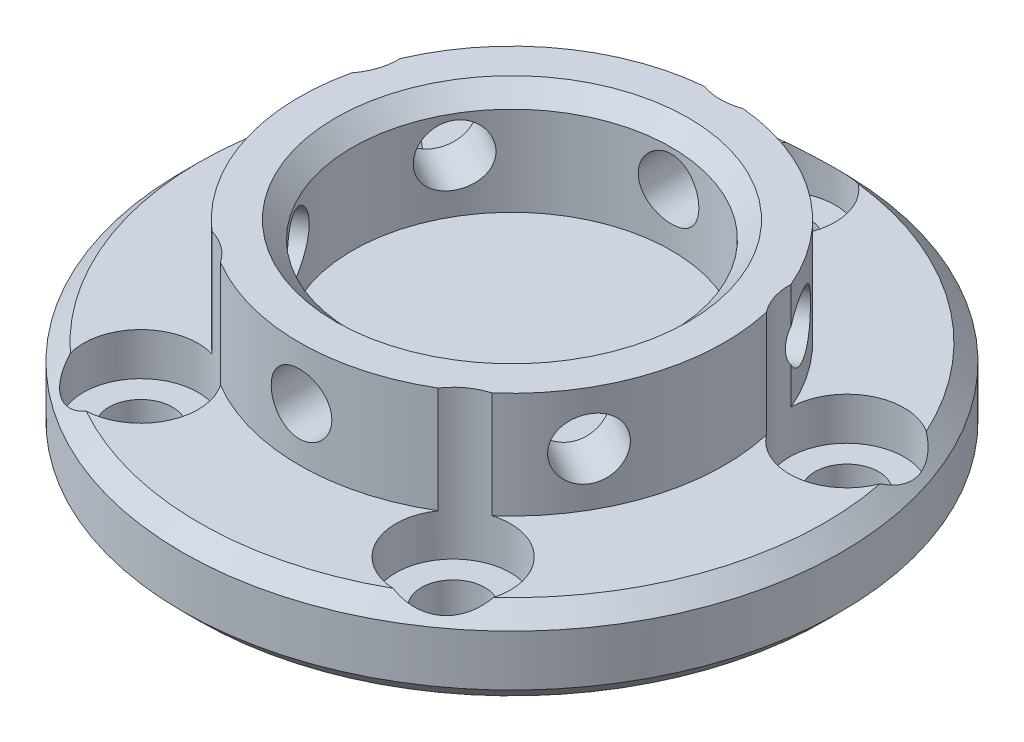
from build123d import *

# Parameters (mm, degrees)
SKETCH_1_R               = 15.5
SKETCH_1_R_2             = 1.5
EXTRUDE_1_DEPTH          = 4
SKETCH_2_R               = 10
SKETCH_2_R_2             = 7.5
EXTRUDE_2_DEPTH          = 5
SKETCH_5_R               = 2.7
CUT_EXTRUDE_3_DEPTH      = 24.010866998
SKETCH_6_R               = 1.425
CUT_EXTRUDE_4_DEPTH      = 20
PATTERN_CIRCULAR_2_COUNT = 3
CHAMFER_1_SIZE           = 0.8


with BuildPart() as part:
    # 草图1 → 凸台-拉伸1 (new body)
    with BuildSketch(Plane(origin=(0, 0, 0), x_dir=(1, 0, 0), z_dir=(0, 1, 0))):
        with Locations(Location((0, 0, 0), (0, 0, 270))):
            Circle(SKETCH_1_R)
        with Locations(Location((0, 12.5, 0), (0, 0, 270))):
            Circle(SKETCH_1_R_2, mode=Mode.SUBTRACT)
        with Locations(Location((11.888206454, 3.86271243, 0), (0, 0, 270))):
            Circle(SKETCH_1_R_2, mode=Mode.SUBTRACT)
        with Locations(Location((7.347315654, -10.11271243, 0), (0, 0, 270))):
            Circle(SKETCH_1_R_2, mode=Mode.SUBTRACT)
        with Locations(Location((-7.347315654, -10.11271243, 0), (0, 0, 270))):
            Circle(SKETCH_1_R_2, mode=Mode.SUBTRACT)
        with Locations(Location((-11.888206454, 3.86271243, 0), (0, 0, 270))):
            Circle(SKETCH_1_R_2, mode=Mode.SUBTRACT)
    extrude(amount=EXTRUDE_1_DEPTH)

    # 草图2 → 凸台-拉伸2 (add)
    with BuildSketch(Plane(origin=(0, 4, 0), x_dir=(1, 0, 0), z_dir=(0, 1, 0))):
        with Locations(Location((0, 0, 0), (0, 0, 270))):
            Circle(SKETCH_2_R)
        with Locations(Location((0, 0, 0), (0, 0, 270))):
            Circle(SKETCH_2_R_2, mode=Mode.SUBTRACT)
    extrude(amount=EXTRUDE_2_DEPTH)

    # 草图5 → 切除-拉伸3 (cut, through all)
    with BuildSketch(Plane(origin=(0, 2, 0), x_dir=(1, 0, 0), z_dir=(0, 1, 0))):
        with Locations(Location((0, 12.5, 0), (0, 0, 250.276691528))):
            Circle(SKETCH_5_R)
        with Locations(Location((11.888206454, 3.86271243, 0), (0, 0, 178.276691528))):
            Circle(SKETCH_5_R)
        with Locations(Location((7.347315654, -10.11271243, 0), (0, 0, 106.276691528))):
            Circle(SKETCH_5_R)
        with Locations(Location((-7.347315654, -10.11271243, 0), (0, 0, 73.723308472))):
            Circle(SKETCH_5_R)
        with Locations(Location((-11.888206454, 3.86271243, 0), (0, 0, 1.723308472))):
            Circle(SKETCH_5_R)
    extrude(amount=CUT_EXTRUDE_3_DEPTH, mode=Mode.SUBTRACT)

    # 草图6 → 切除-拉伸4 (cut, symmetric)
    with BuildSketch(Plane.XY):
        with Locations(Location((0, 6.5, 0), (0, 0, 50.25048936))):
            Circle(SKETCH_6_R)
    cut_extrude_4 = extrude(amount=CUT_EXTRUDE_4_DEPTH, both=True, mode=Mode.SUBTRACT)

    # 阵列(圆周)2: 切除-拉伸4 ×3 about axis
    pattern_circular_2_axis = Axis((0, 9, 0), (0, 1, 0))
    for i in range(1, PATTERN_CIRCULAR_2_COUNT):
        add(cut_extrude_4.rotate(pattern_circular_2_axis, i * 360 / PATTERN_CIRCULAR_2_COUNT), mode=Mode.SUBTRACT)

    # 倒角1
    # the kernel refuses this chamfer: 0.8 mm, written as the material it takes off along each edge
    with BuildSketch(Plane(origin=(0, 0, 0), x_dir=(0, 0, 1), z_dir=(-1, 0, 0))) as chamfer_1_piece_1:
        Polygon((15.5, CHAMFER_1_SIZE), (15.5 - CHAMFER_1_SIZE, 0), (15.5, 0), align=None)
    revolve(axis=Axis((0, 0, 0), (0, 1, 0)), mode=Mode.SUBTRACT)
    with BuildSketch(Plane(origin=(0, 9, 0), x_dir=(0, 0, 1), z_dir=(-1, 0, 0))) as chamfer_1_piece_2:
        Polygon((7.5 + CHAMFER_1_SIZE, 0), (7.5, -CHAMFER_1_SIZE), (7.5, 0), align=None)
    revolve(axis=Axis((0, 9, 0), (0, 1, 0)), mode=Mode.SUBTRACT)
    with BuildSketch(Plane(origin=(0, 4, 0), x_dir=(0, 0, 1), z_dir=(-1, 0, 0))) as chamfer_1_piece_3:
        Polygon((15.5, -CHAMFER_1_SIZE), (15.5 - CHAMFER_1_SIZE, 0), (15.5, 0), align=None)
    revolve(axis=Axis((0, 4, 0), (0, 1, 0)), mode=Mode.SUBTRACT)


solid = part.part
